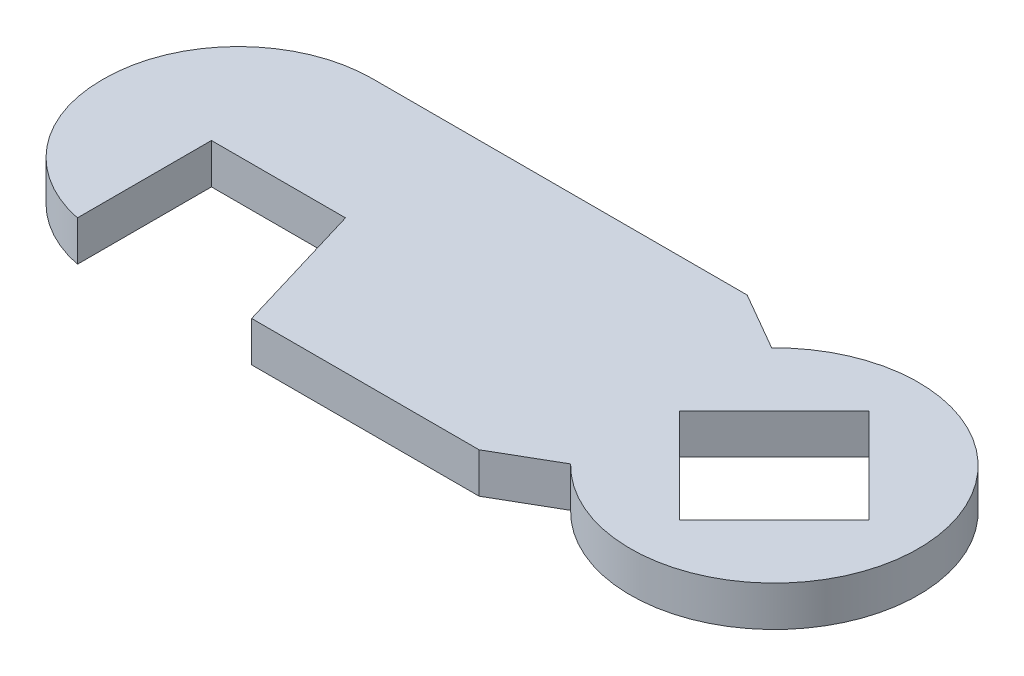
from build123d import *

# Parameters (mm, degrees)
EXTRUDE_1_DEPTH     = 3
CUT_EXTRUDE_1_DEPTH = 52.230484089
CUT_EXTRUDE_3_DEPTH = 10
FILLET_1_R          = 10


with BuildPart() as part:
    # 草图2 → 凸台-拉伸1 (new body)
    with BuildSketch(Plane(origin=(0, 0, 0), x_dir=(1, 0, 0), z_dir=(0, 1, 0))):
        with BuildLine():
            Line((-12.031587919, -10), (-7.7014609, -7.5))
            ThreePointArc((-7.7014609, -7.5), (10.75, 0), (-7.7014609, 7.5))
            Line((-7.7014609, 7.5), (-12.031587919, 10))
            Line((-12.031587919, 10), (-50, 10))
            Line((-50, 10), (-50, -10))
            Line((-50, -10), (-12.031587919, -10))
        make_face()
    extrude(amount=EXTRUDE_1_DEPTH)

    # 草图3 → 切除-拉伸1 (cut, through all)
    with BuildSketch(Plane(origin=(0, 3, 0), x_dir=(1, 0, 0), z_dir=(0, 1, 0))):
        Polygon((0, 7.071067812), (-7.071067812, 0), (0, -7.071067812), (7.071067812, 0), align=None)
    extrude(amount=-CUT_EXTRUDE_1_DEPTH, mode=Mode.SUBTRACT)

    # 草图5 → 切除-拉伸3 (cut)
    with BuildSketch(Plane(origin=(0, 3, 0), x_dir=(1, 0, 0), z_dir=(0, 1, 0))):
        Polygon((-42, -10), (-42, 0), (-32, 0), (-29, -10), align=None)
    extrude(amount=-CUT_EXTRUDE_3_DEPTH, mode=Mode.SUBTRACT)

    # 圆角1
    # the kernel refuses this fillet: 10 mm, written as the material it takes off along each edge
    with BuildSketch(Plane(origin=(-50, -25, -10), x_dir=(0, 0, 1), z_dir=(0, 1, 0))) as fillet_1_piece_1:
        with BuildLine():
            CenterArc((FILLET_1_R, FILLET_1_R), FILLET_1_R, 180, 90)
            Line((0, FILLET_1_R), (-FILLET_1_R * 0.02, FILLET_1_R))
            Line((-FILLET_1_R * 0.02, FILLET_1_R), (-FILLET_1_R * 0.02, -FILLET_1_R * 0.02))
            Line((-FILLET_1_R * 0.02, -FILLET_1_R * 0.02), (FILLET_1_R, -FILLET_1_R * 0.02))
            Line((FILLET_1_R, -FILLET_1_R * 0.02), (FILLET_1_R, 0))
        make_face()
    extrude(amount=53, mode=Mode.SUBTRACT)
    with BuildSketch(Plane(origin=(-50, -24.494897428, 10), x_dir=(1, 0, 0), z_dir=(0, 1, 0))) as fillet_1_piece_2:
        with BuildLine():
            CenterArc((10, 9.797958971), FILLET_1_R, 180, 78.463040967)
            Line((0, 9.797958971), (-0.2, 9.797958971))
            Line((-0.2, 9.797958971), (-0.2, 0))
            Line((-0.2, 0), (0, -0.2))
            ThreePointArc((0, -0.2), (4, -0.2), (7.96, -0.195959179))
            Line((7.96, -0.195959179), (8, 0))
        make_face()
    extrude(amount=51.989794856, mode=Mode.SUBTRACT)


solid = part.part
